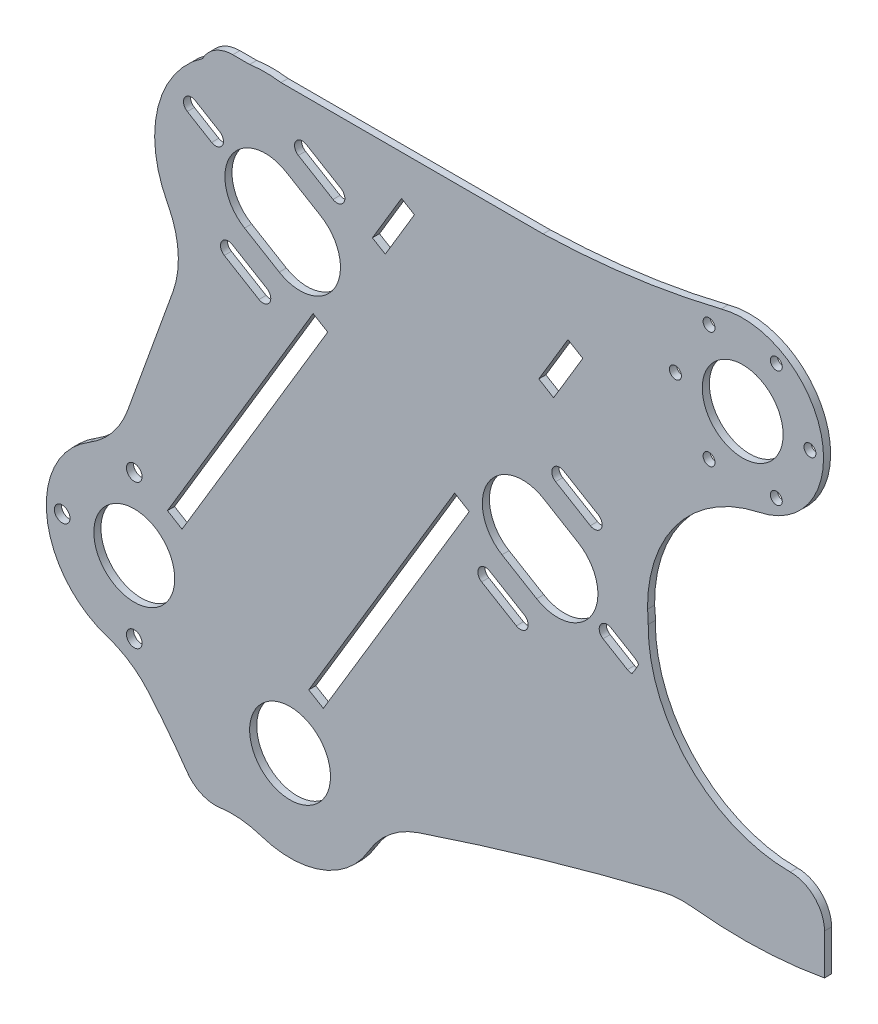
from build123d import *

# Parameters (mm, degrees)
ESBO_O1_R                 = 14.25
RESSALTO_EXTRUS_O1_DEPTH  = 2.5
RESSALTO_EXTRUS_O2_START  = -2.5
RESSALTO_EXTRUS_O2_DEPTH  = 2.5
RESSALTO_EXTRUS_O3_START  = -2.5
RESSALTO_EXTRUS_O3_DEPTH  = 2.5
ESBO_O6_R                 = 14.25
CORTE_EXTRUS_O2_DEPTH     = 424.44839444
ESBO_O8_R                 = 24.626006693
ESBO_O8_R_2               = 14.25
RESSALTO_EXTRUS_O4_DEPTH  = 2.5
FILETE1_R                 = 12
FILETE2_R                 = 12
FILETE3_R                 = 12
FILETE4_R                 = 12
ESBO_O9_R                 = 39
ESBO_O9_R_2               = 14.25
ESBO_O9_R_3               = 31
RESSALTO_EXTRUS_O5_DEPTH  = 2.5
ESBO_O10_R                = 2.75
CORTE_EXTRUS_O3_DEPTH     = 428.70360435
ESBO_O12_R                = 32
ESBO_O12_R_2              = 14.25
RESSALTO_EXTRUS_O6_DEPTH  = 2.5
CORTE_EXTRUS_O4_DEPTH     = 6
ESBO_O14_R                = 2.75
RESSALTO_EXTRUS_O7_DEPTH  = 2.5
CORTE_EXTRUS_O5_DEPTH     = 10
RESSALTO_EXTRUS_O8_START  = -2.5
ESBO_O16_R                = 28.5
ESBO_O16_R_2              = 14.25
RESSALTO_EXTRUS_O8_DEPTH  = 2.5
FILETE6_R                 = 12
FILETE7_R                 = 32
FILETE8_R                 = 12
FILETE9_R                 = 12
FILETE10_R                = 12
ESBO_O18_R                = 2.1
CORTE_EXTRUS_O7_DEPTH     = 436.823247896
CORTE_EXTRUS_O8_DEPTH     = 10
CORTE_EXTRUS_O9_DEPTH     = 10
RESSALTO_EXTRUS_O9_DEPTH  = 2.5
RESSALTO_EXTRUS_O10_START = -2.5
RESSALTO_EXTRUS_O10_DEPTH = 2.5
RESSALTO_EXTRUS_O11_DEPTH = 2.5


with BuildPart() as part:
    # Esboço1 → Ressalto-extrusão1 (new body)
    with BuildSketch(Plane.XY):
        with BuildLine():
            Line((49.9, 342), (-3.275752253, 342))
            Line((-3.275752253, 342), (-3.275752253, 208.903519527))
            ThreePointArc((-3.275752253, 208.903519527), (-86.772882258, 275.668158023), (-110.1, 380))
            Line((-110.1, 380), (49.9, 380))
            ThreePointArc((49.9, 380), (68.9, 361), (49.9, 342))
        make_face()
        with Locations((49.9, 361)):
            Circle(ESBO_O1_R, mode=Mode.SUBTRACT)
    extrude(amount=RESSALTO_EXTRUS_O1_DEPTH)

    # Esboço3 → Ressalto-extrusão2 (add)
    with BuildSketch(Plane.XY.offset(2.5).offset(RESSALTO_EXTRUS_O2_START)):
        with BuildLine():
            Line((78.724247747, 230.983178344), (78.724247747, 202.475040634))
            ThreePointArc((78.724247747, 202.475040634), (37.307133839, 200.368683869), (-3.275752253, 208.903519527))
            Line((-3.275752253, 208.903519527), (-3.275752253, 238.903519527))
            ThreePointArc((-3.275752253, 238.903519527), (37.096410892, 228.443297878), (78.724247747, 230.983178344))
        make_face()
    extrude(amount=RESSALTO_EXTRUS_O2_DEPTH)

    # Esboço5 → Ressalto-extrusão3 (add)
    with BuildSketch(Plane.XY.offset(2.5).offset(RESSALTO_EXTRUS_O3_START)):
        with BuildLine():
            ThreePointArc((27.063337232, 201.502392389), (-77.860167086, 262.82495375), (-110.1, 380))
            Line((-110.1, 380), (-141.93126047, 380))
            Line((-141.93126047, 380), (-141.262689275, 323.724600086))
            Line((-141.262689275, 323.724600086), (-186.821553236, 197.639080724))
            ThreePointArc((-186.821553236, 197.639080724), (-162.10673209, 173.633555912), (-141.262689275, 146.199754045))
            ThreePointArc((-141.262689275, 146.199754045), (-58.233094615, 177.300887798), (27.063337232, 201.502392389))
        make_face()
    extrude(amount=RESSALTO_EXTRUS_O3_DEPTH)

    # Esboço6 → Corte-extrusão2 (cut, through all)
    with BuildSketch(Plane.XY.offset(2.5)):
        with Locations((-118.329389294, 341.392849413)):
            Circle(ESBO_O6_R)
        with Locations((-15.382462369, 279.733055084)):
            Circle(ESBO_O6_R)
        with Locations((-164.513179324, 209.792033264)):
            Circle(ESBO_O6_R)
        with Locations((-109.608151631, 176.906809621)):
            Circle(ESBO_O6_R)
    extrude(amount=-CORTE_EXTRUS_O2_DEPTH, mode=Mode.SUBTRACT)

    # Esboço8 → Ressalto-extrusão4 (add)
    with BuildSketch(Plane.XY.offset(2.5)):
        with Locations((-164.513179324, 209.792033264)):
            Circle(ESBO_O8_R)
        with Locations((-164.513179324, 209.792033264)):
            Circle(ESBO_O8_R_2, mode=Mode.SUBTRACT)
    extrude(amount=-RESSALTO_EXTRUS_O4_DEPTH)

    # Filete1
    filete1_edges = [part.edges().sort_by_distance(p)[0] for p in [
        (-174.258497593, 232.407713167, 1.25),
    ]]
    fillet(filete1_edges, radius=FILETE1_R)

    # Filete2
    filete2_edges = [part.edges().sort_by_distance(p)[0] for p in [
        (-3.275752253, 238.903519527, 1.25),
        (-141.262689275, 323.724600086, 1.25),
        (-141.93126047, 380, 1.25),
    ]]
    fillet(filete2_edges, radius=FILETE2_R)

    # Filete3
    filete3_edges = [part.edges().sort_by_distance(p)[0] for p in [
        (78.724247747, 230.983178344, 1.25),
    ]]
    fillet(filete3_edges, radius=FILETE3_R)

    # Filete4
    filete4_edges = [part.edges().sort_by_distance(p)[0] for p in [
        (-3.275752253, 342, 1.25),
    ]]
    fillet(filete4_edges, radius=FILETE4_R)

    # Esboço9 → Ressalto-extrusão5 (add)
    # profile 1 of 2: a face of its own
    with BuildSketch(Plane.XY.offset(2.5)):
        with Locations((-118.329389294, 341.392849413)):
            Circle(ESBO_O9_R)
        with Locations((-118.329389294, 341.392849413)):
            Circle(ESBO_O9_R_2, mode=Mode.SUBTRACT)
    # profile 2 of 2: a face of its own
    with BuildSketch(Plane.XY.offset(2.5)):
        with Locations((-164.513179324, 209.792033264)):
            Circle(ESBO_O9_R_3)
        with Locations((-164.513179324, 209.792033264)):
            Circle(ESBO_O9_R_2, mode=Mode.SUBTRACT)
    extrude(amount=-RESSALTO_EXTRUS_O5_DEPTH)

    # Esboço10 → Corte-extrusão3 (cut, through all)
    with BuildSketch(Plane.XY.offset(2.5)):
        with Locations((-189.913179324, 209.792033264)):
            Circle(ESBO_O10_R)
        with Locations((-164.513179324, 235.192033264)):
            Circle(ESBO_O10_R)
        with Locations((-139.113179324, 209.792033264)):
            Circle(ESBO_O10_R)
        with Locations((-164.513179324, 184.392033264)):
            Circle(ESBO_O10_R)
    extrude(amount=-CORTE_EXTRUS_O3_DEPTH, mode=Mode.SUBTRACT)

    # Esboço12 → Ressalto-extrusão6 (add)
    # profile 1 of 2: a face of its own
    with BuildSketch(Plane.XY.offset(2.5)):
        with Locations((-109.608151631, 176.906809621)):
            Circle(ESBO_O12_R)
        with Locations((-109.608151631, 176.906809621)):
            Circle(ESBO_O12_R_2, mode=Mode.SUBTRACT)
    # profile 2 of 2: a face of its own
    with BuildSketch(Plane.XY.offset(2.5)):
        with Locations((-15.382462369, 279.733055084)):
            Circle(ESBO_O12_R)
        with Locations((-15.382462369, 279.733055084)):
            Circle(ESBO_O12_R_2, mode=Mode.SUBTRACT)
    extrude(amount=-RESSALTO_EXTRUS_O6_DEPTH)

    # Esboço13 → Corte-extrusão4 (cut)
    with BuildSketch(Plane.XY.offset(2.5)):
        Polygon((-96.338562846, 312.074187366), (-147.673216901, 226.25604655), (-152.82230535, 229.336125793), (-101.487651295, 315.154266609), align=None)
        Polygon((-103.03073276, 199.54728787), (-51.612530365, 285.315396526), (-46.466443845, 282.230304383), (-97.884646241, 196.462195727), align=None)
    extrude(amount=-CORTE_EXTRUS_O4_DEPTH, mode=Mode.SUBTRACT)

    # Esboço14 → Ressalto-extrusão7 (add)
    with BuildSketch(Plane.XY.offset(2.5)):
        with Locations((-139.113179324, 209.792033264)):
            Circle(ESBO_O14_R)
    extrude(amount=-RESSALTO_EXTRUS_O7_DEPTH)

    # Esboço15 → Corte-extrusão5 (cut)
    with BuildSketch(Plane(origin=(0, 0, 0), x_dir=(-1, 0, 0), z_dir=(0, 0, -1))):
        Polygon((6.445901446, 348.986551569), (16.729541925, 331.832929838), (21.960000657, 334.968603341), (11.676360178, 352.122225072), align=None)
        Polygon((65.780867258, 363.158677391), (76.047798069, 345.995049227), (80.596428549, 348.715946812), (70.329497738, 365.879574976), align=None)
    extrude(amount=-CORTE_EXTRUS_O5_DEPTH, mode=Mode.SUBTRACT)

    # Esboço16 → Ressalto-extrusão8 (add)
    with BuildSketch(Plane.XY.offset(2.5).offset(RESSALTO_EXTRUS_O8_START)):
        with Locations((49.9, 361)):
            Circle(ESBO_O16_R)
        with Locations((49.9, 361)):
            Circle(ESBO_O16_R_2, mode=Mode.SUBTRACT)
    extrude(amount=RESSALTO_EXTRUS_O8_DEPTH)

    # Filete6
    filete6_edges = [part.edges().sort_by_distance(p)[0] for p in [
        (28.657354214, 342, 1.25),
        (28.657354214, 380, 1.25),
    ]]
    fillet(filete6_edges, radius=FILETE6_R)

    # Filete7
    # the kernel refuses this fillet: 32 mm, written as the material it adds along each edge
    with BuildSketch(Plane(origin=(-145.119575988, 313.05055069, 0), x_dir=(-0.6065801455466366, 0.795022343729169, 0), z_dir=(0, 0, 1))) as filete7_piece_1:
        with BuildLine():
            CenterArc((17.719492192, 31.58209042), FILETE7_R, 212.790903827, 47.939142028)
            Line((-9.1813908, 14.251698207), (-9.71940846, 13.905090363))
            Line((-9.71940846, 13.905090363), (-0.53801766, -0.346607844))
            Line((-0.53801766, -0.346607844), (0.103095227, -0.631641808))
            ThreePointArc((0.103095227, -0.631641808), (6.282365413, -0.130672699), (12.4616356, -0.631641808))
            Line((12.4616356, -0.631641808), (12.564730827, 0))
        make_face()
    extrude(amount=2.5)
    with BuildSketch(Plane(origin=(-166.904490399, 178.884402631, 2.5), x_dir=(-0.9812085080555987, 0.1929504177743761, 0), z_dir=(0, 0, -1))) as filete7_piece_2:
        with BuildLine():
            CenterArc((10.968482395, -31.78140347), FILETE7_R, 96.700879529, 31.64298617)
            Line((-8.883667224, -6.683751079), (-9.280710216, -6.181798032))
            ThreePointArc((-9.280710216, -6.181798032), (-4.867069609, -2.776675692), (-0.372278024, 0.520585317))
            Line((-0.372278024, 0.520585317), (0.074679029, 0.635628069))
            ThreePointArc((0.074679029, 0.635628069), (3.617265471, 0.428234612), (7.159851912, 0.635628069))
            Line((7.159851912, 0.635628069), (7.234530941, 0))
        make_face()
    extrude(amount=2.5)
    with BuildSketch(Plane(origin=(-171.518737142, 239.990082201, 0), x_dir=(0.33982910043770986, 0.9404872048548544, 0), z_dir=(0, 0, 1))) as filete7_piece_3:
        with BuildLine():
            CenterArc((13.761694577, 32), FILETE7_R, 230.842195329, 39.157804671)
            Line((-6.444975037, 7.186888484), (-6.849108429, 6.690626254))
            ThreePointArc((-6.849108429, 6.690626254), (-3.417493232, 3.418569265), (-0.537190941, -0.347887758))
            Line((-0.537190941, -0.347887758), (0, -0.64))
            Line((0, -0.64), (13.761694577, -0.64))
            Line((13.761694577, -0.64), (13.761694577, 0))
        make_face()
    extrude(amount=2.5)
    with BuildSketch(Plane(origin=(-78.254961291, 170.505446051, 2.5), x_dir=(-0.3543782836205589, -0.9351021506221376, 0), z_dir=(0, 0, -1))) as filete7_piece_4:
        with BuildLine():
            CenterArc((15.37488281, -31.58693995), FILETE7_R, 99.215894786, 41.500784387)
            Line((-9.393903053, -11.325961521), (-9.88927877, -10.920741953))
            ThreePointArc((-9.88927877, -10.920741953), (-5.208807395, -5.238440699), (-0.489821515, 0.411916113))
            Line((-0.489821515, 0.411916113), (0.102499219, 0.631738799))
            ThreePointArc((0.102499219, 0.631738799), (5.124960937, 0.22693995), (10.147422654, 0.631738799))
            Line((10.147422654, 0.631738799), (10.249921873, 0))
        make_face()
    extrude(amount=2.5)
    with BuildSketch(Plane(origin=(-128.858382026, 151.34455953, 2.5), x_dir=(-0.9237011092502482, -0.3831139005176673, 0), z_dir=(0, 0, -1))) as filete7_piece_5:
        with BuildLine():
            CenterArc((14.50808926, -31.981797811), FILETE7_R, 91.932613611, 39.180201641)
            Line((-6.533311624, -7.87247495), (-6.954139642, -7.390288493))
            ThreePointArc((-6.954139642, -7.390288493), (-3.442511767, -3.790295854), (-0.55149425, 0.324736958))
            Line((-0.55149425, 0.324736958), (-0.003969965, 0.639987687))
            ThreePointArc((-0.003969965, 0.639987687), (6.714459431, 0.660825334), (13.407335454, 0.639635956))
            Line((13.407335454, 0.639635956), (13.428918862, 0))
        make_face()
    extrude(amount=2.5)
    with BuildSketch(Plane(origin=(27.063337232, 201.502392389, 0), x_dir=(-0.971751230176269, -0.23600751397128825, 0), z_dir=(0, 0, 1))) as filete7_piece_6:
        with BuildLine():
            CenterArc((5.874027095, 31.999878645), FILETE7_R, 250.108614679, 20.049179947)
            Line((-5.013594338, 1.909021237), (-5.231346767, 1.307204089))
            ThreePointArc((-5.231346767, 1.307204089), (-2.726592558, 0.377269834), (-0.237666885, -0.594234341))
            Line((-0.237666885, -0.594234341), (-0.001762581, -0.639997573))
            ThreePointArc((-0.001762581, -0.639997573), (2.981078064, -0.644105), (5.963918709, -0.639997573))
            Line((5.963918709, -0.639997573), (5.962156129, 0))
        make_face()
    extrude(amount=2.5)

    # Filete8
    # the kernel refuses this fillet: 12 mm, written as the material it adds along each edge
    with BuildSketch(Plane(origin=(-3.275752253, 250.111651164, 0), x_dir=(0.891196029676298, 0.4536183822214474, 0), z_dir=(0, 0, 1))) as filete8_piece_1:
        with BuildLine():
            CenterArc((6.287483176, -11.958863934), FILETE8_R, 94.745506014, 35.06044637)
            Line((-1.394790968, -2.740259702), (-1.548436451, -2.555887618))
            ThreePointArc((-1.548436451, -2.555887618), (-0.911282531, -1.261261439), (-0.213887047, 0.108868412))
            Line((-0.213887047, 0.108868412), (0.01985521, 0.239177279))
            ThreePointArc((0.01985521, 0.239177279), (2.647361337, 0.130303823), (5.274867464, 0.239177279))
            Line((5.274867464, 0.239177279), (5.294722674, 0))
        make_face()
    extrude(amount=2.5)

    # Filete9
    filete9_edges = [part.edges().sort_by_distance(p)[0] for p in [
        (-3.275752253, 309.354459004, 1.25),
    ]]
    fillet(filete9_edges, radius=FILETE9_R)

    # Filete10
    filete10_edges = [part.edges().sort_by_distance(p)[0] for p in [
        (-141.262689275, 146.199754045, 1.25),
    ]]
    fillet(filete10_edges, radius=FILETE10_R)

    # Esboço18 → Corte-extrusão7 (cut, through all)
    with BuildSketch(Plane.XY.offset(2.5)):
        with Locations((38.05, 381.52480207)):
            Circle(ESBO_O18_R)
        with Locations((61.75, 381.52480207)):
            Circle(ESBO_O18_R)
        with Locations((73.6, 361)):
            Circle(ESBO_O18_R)
        with Locations((26.2, 361)):
            Circle(ESBO_O18_R)
        with Locations((38.05, 340.47519793)):
            Circle(ESBO_O18_R)
        with Locations((61.75, 340.47519793)):
            Circle(ESBO_O18_R)
    extrude(amount=-CORTE_EXTRUS_O7_DEPTH, mode=Mode.SUBTRACT)

    # Esboço19 → Corte-extrusão8 (cut)
    with BuildSketch(Plane.XY.offset(2.5)):
        with BuildLine():
            Line((-111.007288718, 353.617796985), (-98.782341146, 346.295696409))
            ThreePointArc((-98.782341146, 346.295696409), (-93.87949415, 326.74864826), (-113.426542299, 321.845801264))
            Line((-113.426542299, 321.845801264), (-125.651489871, 329.167901841))
            ThreePointArc((-125.651489871, 329.167901841), (-130.554336867, 348.714949989), (-111.007288718, 353.617796985))
        make_face()
        with BuildLine():
            Line((-22.704562946, 267.508107512), (-34.929510518, 274.830208088))
            ThreePointArc((-34.929510518, 274.830208088), (-39.832357514, 294.377256237), (-20.285309365, 299.280103233))
            Line((-20.285309365, 299.280103233), (-8.060361793, 291.958002656))
            ThreePointArc((-8.060361793, 291.958002656), (-3.157514797, 272.410954507), (-22.704562946, 267.508107512))
        make_face()
    extrude(amount=-CORTE_EXTRUS_O8_DEPTH, mode=Mode.SUBTRACT)

    # Esboço20 → Corte-extrusão9 (cut)
    with BuildSketch(Plane.XY.offset(2.5)):
        with BuildLine():
            Line((-103.865029208, 365.542482687), (-91.640081636, 358.220382111))
            ThreePointArc((-91.640081636, 358.220382111), (-90.69391818, 354.448144749), (-94.466155543, 353.501981293))
            Line((-94.466155543, 353.501981293), (-106.691103115, 360.82408187))
            ThreePointArc((-106.691103115, 360.82408187), (-107.63726657, 364.596319232), (-103.865029208, 365.542482687))
        make_face()
        with BuildLine():
            Line((-142.996240495, 359.372531052), (-134.417329918, 354.234214858))
            ThreePointArc((-134.417329918, 354.234214858), (-133.471166463, 350.461977495), (-137.243403825, 349.51581404))
            Line((-137.243403825, 349.51581404), (-145.822314402, 354.654130234))
            ThreePointArc((-145.822314402, 354.654130234), (-146.768477858, 358.426367596), (-142.996240495, 359.372531052))
        make_face()
        with BuildLine():
            Line((-129.967675474, 321.961616956), (-117.742727902, 314.639516379))
            ThreePointArc((-117.742727902, 314.639516379), (-116.796564446, 310.867279017), (-120.568801808, 309.921115562))
            Line((-120.568801808, 309.921115562), (-132.793749381, 317.243216138))
            ThreePointArc((-132.793749381, 317.243216138), (-133.739912836, 321.0154535), (-129.967675474, 321.961616956))
        make_face()
        with BuildLine():
            Line((12.090158242, 266.587174222), (3.506215493, 271.717079375))
            ThreePointArc((3.506215493, 271.717079375), (-0.26509268, 270.767219035), (0.684767659, 266.995910862))
            Line((0.684767659, 266.995910862), (9.268710408, 261.86600571))
            ThreePointArc((9.268710408, 261.86600571), (13.040018581, 262.815866049), (12.090158242, 266.587174222))
        make_face()
        with BuildLine():
            Line((-27.034986804, 260.378871303), (-39.267105222, 267.688986145))
            ThreePointArc((-39.267105222, 267.688986145), (-43.038413395, 266.739125806), (-42.088553056, 262.967817633))
            Line((-42.088553056, 262.967817633), (-29.856434638, 255.657702791))
            ThreePointArc((-29.856434638, 255.657702791), (-26.085126465, 256.60756313), (-27.034986804, 260.378871303))
        make_face()
        with BuildLine():
            Line((-0.975068628, 303.985300469), (-13.207187046, 311.295415312))
            ThreePointArc((-13.207187046, 311.295415312), (-16.978495219, 310.345554973), (-16.02863488, 306.5742468))
            Line((-16.02863488, 306.5742468), (-3.796516462, 299.264131957))
            ThreePointArc((-3.796516462, 299.264131957), (-0.025208289, 300.213992296), (-0.975068628, 303.985300469))
        make_face()
    extrude(amount=-CORTE_EXTRUS_O9_DEPTH, mode=Mode.SUBTRACT)

    # Esboço21 → Ressalto-extrusão9 (add)
    with BuildSketch(Plane.XY.offset(2.5)):
        with BuildLine():
            ThreePointArc((16.614795754, 279.314160594), (31.056060262, 243.565034213), (66.674535232, 228.804465169))
            ThreePointArc((66.674535232, 228.804465169), (35.088549451, 227.170075902), (4.646552816, 235.750901442))
            ThreePointArc((4.646552816, 235.750901442), (-7.144342037, 242.184826437), (1.442883572, 252.513434698))
            ThreePointArc((1.442883572, 252.513434698), (12.465004195, 263.96858218), (16.614795754, 279.314160594))
        make_face()
    extrude(amount=-RESSALTO_EXTRUS_O9_DEPTH)

    # Esboço23 → Ressalto-extrusão10 (add)
    with BuildSketch(Plane.XY.offset(2.5).offset(RESSALTO_EXTRUS_O10_START)):
        with BuildLine():
            Line((-20.427812302, 380), (23.83757494, 380))
            ThreePointArc((23.83757494, 380), (27.947184275, 380.72564365), (31.559774958, 382.814814815))
            ThreePointArc((31.559774958, 382.814814815), (36.62592012, 386.220007997), (42.301000601, 388.468258193))
            ThreePointArc((42.301000601, 388.468258193), (11.161749739, 382.566284002), (-20.427812302, 380))
        make_face()
    extrude(amount=RESSALTO_EXTRUS_O10_DEPTH)

    # Esboço24 → Ressalto-extrusão11 (add)
    with BuildSketch(Plane.XY.offset(2.5)):
        with BuildLine():
            ThreePointArc((16.354837382, 283.824974502), (27.263439991, 315.528468743), (55.806257606, 333.118713783))
            ThreePointArc((55.806257606, 333.118713783), (42.982528976, 333.352240694), (31.559774958, 339.185185185))
            ThreePointArc((31.559774958, 339.185185185), (27.947184275, 341.27435635), (23.83757494, 342))
            Line((23.83757494, 342), (8.724247747, 342))
            ThreePointArc((8.724247747, 342), (0.238966372, 338.485281374), (-3.275752253, 330))
            Line((-3.275752253, 330), (-3.275752253, 316.5415667))
            ThreePointArc((-3.275752253, 316.5415667), (-1.832614658, 310.836073192), (2.149690442, 306.502881714))
            ThreePointArc((2.149690442, 306.502881714), (11.736564306, 296.720061653), (16.354837382, 283.824974502))
        make_face()
    extrude(amount=-RESSALTO_EXTRUS_O11_DEPTH)


solid = part.part
